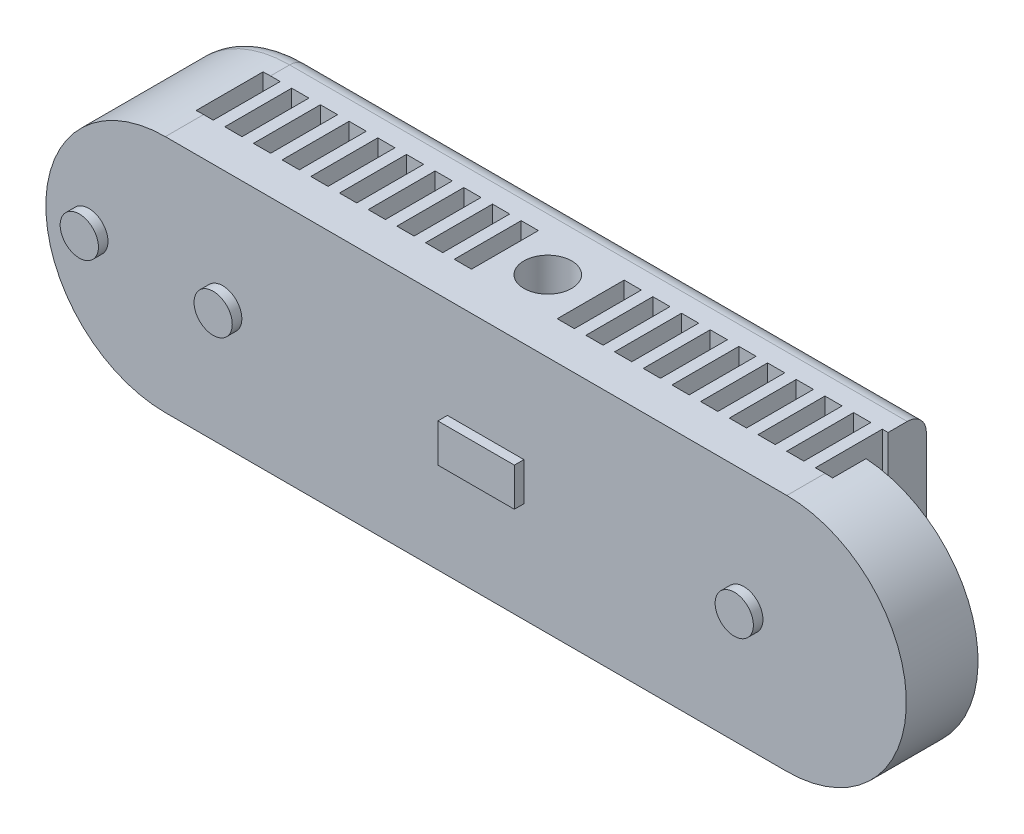
from build123d import *

# Parameters (mm, degrees)
SKETCH_1_W           = 90
SKETCH_1_H           = 25
EXTRUDE_1_DEPTH      = 15
CUT_EXTRUDE_1_DEPTH  = 15
SKETCH_3_R           = 2.5
CUT_EXTRUDE_2_DEPTH  = 15
SKETCH_4_W           = 1.8
SKETCH_4_H           = 7
CUT_EXTRUDE_3_DEPTH  = 5
SKETCH_5_R           = 1.65
CUT_EXTRUDE_4_DEPTH  = 5
SKETCH_6_W           = 20
SKETCH_6_H           = 2.5
CUT_EXTRUDE_5_DEPTH  = 5
CUT_EXTRUDE_7_DEPTH  = 7.5
CUT_EXTRUDE_8_DEPTH  = 7.5
SKETCH_9_R           = 2
SKETCH_9_W           = 8
SKETCH_9_H           = 4
EXTRUDE_2_DEPTH      = 1
FILLET_1_R           = 2
CUT_EXTRUDE_10_REACH = 51.369
SKETCH_15_W          = 17.204453114
SKETCH_15_H          = 35.420932882


with BuildPart() as part:
    # 草图1 → 凸台-拉伸1 (new body)
    with BuildSketch(Plane.XY):
        Rectangle(SKETCH_1_W, SKETCH_1_H)
    extrude(amount=EXTRUDE_1_DEPTH)

    # 草图2 → 切除-拉伸1 (cut)
    with BuildSketch(Plane.XY.offset(15)):
        with BuildLine():
            Line((-32.5, 12.5), (-61.464378833, 12.5))
            Line((-61.464378833, 12.5), (-61.464378833, -12.5))
            Line((-61.464378833, -12.5), (-32.5, -12.5))
            ThreePointArc((-32.5, -12.5), (-45, 0), (-32.5, 12.5))
        make_face()
        with BuildLine():
            Line((32.5, 12.5), (60.882590951, 12.5))
            Line((60.882590951, 12.5), (60.882590951, -12.5))
            Line((60.882590951, -12.5), (32.5, -12.5))
            ThreePointArc((32.5, -12.5), (45, 0), (32.5, 12.5))
        make_face()
    extrude(amount=-CUT_EXTRUDE_1_DEPTH, mode=Mode.SUBTRACT)

    # 草图3 → 切除-拉伸2 (cut)
    with BuildSketch(Plane(origin=(0, 12.5, 0), x_dir=(1, 0, 0), z_dir=(0, 1, 0))):
        with Locations(Location((0, -7.5, 0), (0, 0, 180))):
            Circle(SKETCH_3_R)
    extrude(amount=-CUT_EXTRUDE_2_DEPTH, mode=Mode.SUBTRACT)

    # 草图4 → 切除-拉伸3 (cut)
    with BuildSketch(Plane(origin=(0, 12.5, 0), x_dir=(1, 0, 0), z_dir=(0, 1, 0))):
        with Locations((-8.384632086, -7.5)):
            Rectangle(SKETCH_4_W, SKETCH_4_H)
        with Locations((-5.384632086, -7.5)):
            Rectangle(SKETCH_4_W, SKETCH_4_H)
        with Locations((-11.384632086, -7.5)):
            Rectangle(SKETCH_4_W, SKETCH_4_H)
        with Locations((-14.384632086, -7.5)):
            Rectangle(SKETCH_4_W, SKETCH_4_H)
        with Locations((-17.384632086, -7.5)):
            Rectangle(SKETCH_4_W, SKETCH_4_H)
        with Locations((-20.384632086, -7.5)):
            Rectangle(SKETCH_4_W, SKETCH_4_H)
        with Locations((-23.384632086, -7.5)):
            Rectangle(SKETCH_4_W, SKETCH_4_H)
        with Locations((-26.384632086, -7.5)):
            Rectangle(SKETCH_4_W, SKETCH_4_H)
        with Locations((-29.384632086, -7.5)):
            Rectangle(SKETCH_4_W, SKETCH_4_H)
        with Locations((-32.384632086, -7.5)):
            Rectangle(SKETCH_4_W, SKETCH_4_H)
    cut_extrude_3 = extrude(amount=-CUT_EXTRUDE_3_DEPTH, mode=Mode.SUBTRACT)

    # 镜向1: 切除-拉伸3 across plane
    add(cut_extrude_3.mirror(Plane(origin=(0, 0, 0), x_dir=(0, 0, 1), z_dir=(1, 0, 0))), mode=Mode.SUBTRACT)

    # 草图5 → 切除-拉伸4 (cut)
    with BuildSketch(Plane(origin=(0, 0, 0), x_dir=(-1, 0, 0), z_dir=(0, 0, -1))):
        with Locations((-22.5, 0)):
            Circle(SKETCH_5_R)
        with Locations((22.5, 0)):
            Circle(SKETCH_5_R)
    extrude(amount=-CUT_EXTRUDE_4_DEPTH, mode=Mode.SUBTRACT)

    # 草图6 → 切除-拉伸5 (cut)
    with BuildSketch(Plane.XZ.offset(12.5)):
        with Locations((0, 2.5)):
            Rectangle(SKETCH_6_W, SKETCH_6_H)
    extrude(amount=-CUT_EXTRUDE_5_DEPTH, mode=Mode.SUBTRACT)

    # 草图7 → 切除-拉伸7 (cut)
    with BuildSketch(Plane(origin=(0, 0, 0), x_dir=(-1, 0, 0), z_dir=(0, 0, -1))):
        with BuildLine():
            Line((-32.5, 9), (-32.5, -9))
            ThreePointArc((-32.5, -9), (-41.5, 0), (-32.5, 9))
        make_face()
    extrude(amount=-CUT_EXTRUDE_7_DEPTH, mode=Mode.SUBTRACT)

    # 草图8 → 切除-拉伸8 (cut)
    with BuildSketch(Plane(origin=(32.5, 0, 0), x_dir=(0, 0, -1), z_dir=(1, 0, 0))):
        with BuildLine():
            Line((-1.91780044, -4), (-1.91780044, 4))
            ThreePointArc((-1.91780044, 4), (-2.91780044, 5), (-3.91780044, 4))
            Line((-3.91780044, 4), (-3.91780044, -4))
            ThreePointArc((-3.91780044, -4), (-2.91780044, -5), (-1.91780044, -4))
        make_face()
    extrude(amount=-CUT_EXTRUDE_8_DEPTH, mode=Mode.SUBTRACT)

    # 草图9 → 凸台-拉伸2 (add)
    with BuildSketch(Plane.XY.offset(15)):
        with Locations((28, 0)):
            Circle(SKETCH_9_R)
        with Locations((-26.5, 0)):
            Circle(SKETCH_9_R)
        with Locations((-40.5, 0)):
            Circle(SKETCH_9_R)
        with Locations((1, 0)):
            Rectangle(SKETCH_9_W, SKETCH_9_H)
    extrude(amount=EXTRUDE_2_DEPTH)

    # 圆角1
    # the kernel refuses this fillet: 2 mm, written as the material it takes off along each edge
    with BuildSketch(Plane(origin=(32.5, -12.5, 0), x_dir=(0, 0, 1), z_dir=(-1, 0, 0))) as fillet_1_piece_1:
        with BuildLine():
            CenterArc((FILLET_1_R, FILLET_1_R), FILLET_1_R, 180, 90)
            Line((0, FILLET_1_R), (0, 0))
            Line((0, 0), (FILLET_1_R, 0))
        make_face()
    extrude(amount=65, mode=Mode.SUBTRACT)
    with BuildSketch(Plane(origin=(-32.5, 0, 0), x_dir=(0, -1, 0), z_dir=(1, 0, 0))) as fillet_1_piece_2:
        with BuildLine():
            CenterArc((12.5 - FILLET_1_R, -FILLET_1_R), FILLET_1_R, 0, 90)
            Line((12.5, -FILLET_1_R), (12.5, 0))
            Line((12.5, 0), (12.5 - FILLET_1_R, 0))
        make_face()
    revolve(axis=Axis((-32.5, 0, 0), (0, 0, -1)), revolution_arc=180, mode=Mode.SUBTRACT)
    with BuildSketch(Plane(origin=(-32.5, 12.5, 0), x_dir=(0, -1, 0), z_dir=(1, 0, 0))) as fillet_1_piece_3:
        with BuildLine():
            CenterArc((FILLET_1_R, -FILLET_1_R), FILLET_1_R, 90, 90)
            Line((0, -FILLET_1_R), (0, 0))
            Line((0, 0), (FILLET_1_R, 0))
        make_face()
    extrude(amount=65, mode=Mode.SUBTRACT)
    with BuildSketch(Plane(origin=(32.5, 0, 0), x_dir=(0, 1, 0), z_dir=(-1, 0, 0))) as fillet_1_piece_4:
        with BuildLine():
            CenterArc((12.5 - FILLET_1_R, -FILLET_1_R), FILLET_1_R, 0, 90)
            Line((12.5, -FILLET_1_R), (12.5, 0))
            Line((12.5, 0), (12.5 - FILLET_1_R, 0))
        make_face()
    revolve(axis=Axis((32.5, 0, 0), (0, 0, -1)), revolution_arc=180, mode=Mode.SUBTRACT)

    # 切除-拉伸10: up to this face of the body (flat: up to its plane)
    cut_extrude_10_end = Plane(part.part.faces().sort_by_distance((36.351487084, -0.076382797, 7.5))[0])
    # 草图15 → 切除-拉伸10 (cut, up to the picked face)
    with BuildSketch(Plane(origin=(0, 0, 0), x_dir=(-1, 0, 0), z_dir=(0, 0, -1)), mode=Mode.PRIVATE) as cut_extrude_10_sk1:
        with Locations((-40.69229177, 2.139850544)):
            Rectangle(SKETCH_15_W, SKETCH_15_H)
    cut_extrude_10_tool1 = split(extrude(cut_extrude_10_sk1.sketch, amount=-CUT_EXTRUDE_10_REACH, mode=Mode.PRIVATE), bisect_by=cut_extrude_10_end, keep=Keep.BOTH, mode=Mode.PRIVATE)
    add(cut_extrude_10_tool1.solids().sort_by(Axis((40.692292, 2.139851, 0), (0, 0, 1)))[0], mode=Mode.SUBTRACT)


solid = part.part
